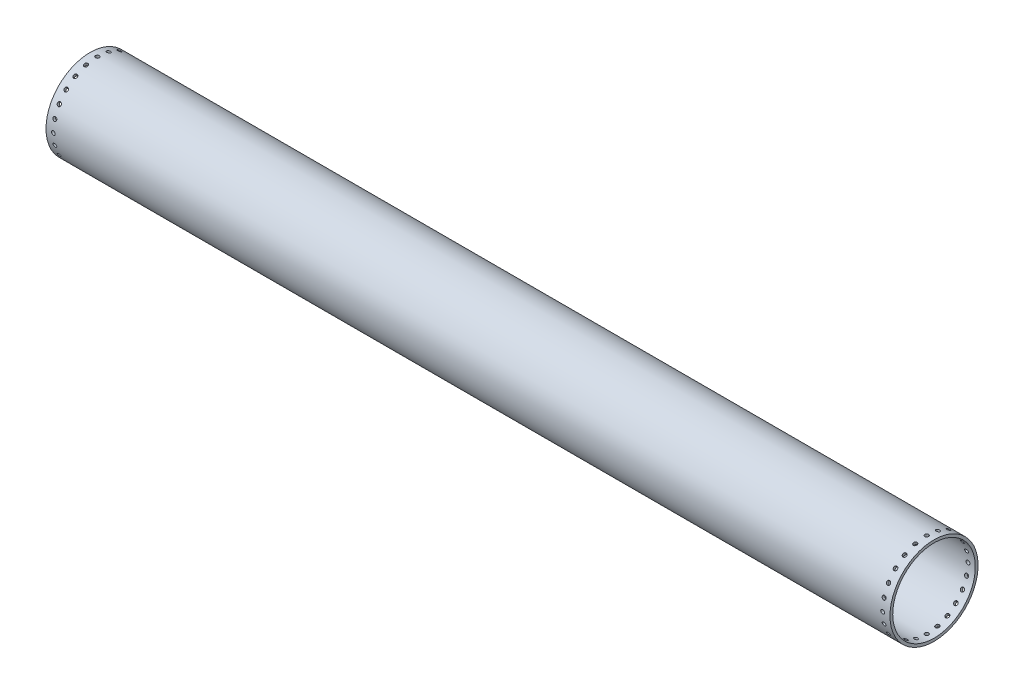
from build123d import *

# Parameters (mm, degrees)
TUBE_SKETCH_W                = 1459.687960479
TUBE_SKETCH_H                = 4.775
TOP_SCREW_HOLE_SKETCH_W      = 3.3
TOP_SCREW_HOLE_SKETCH_H      = 6.775
TOP_SCREW_HOLES_X24_COUNT    = 24
BOTTOM_SCREW_HOLE_SKETCH_W   = 3.3
BOTTOM_SCREW_HOLE_SKETCH_H   = 6.775
BOTTOM_SCREW_HOLES_X24_COUNT = 24


with BuildPart() as part:
    # Tube Sketch → Tube (revolve)
    with BuildSketch(Plane.XY):
        with Locations((729.84398024, 73.8125)):
            Rectangle(TUBE_SKETCH_W, TUBE_SKETCH_H)
    revolve(axis=Axis((-1000, 0, 0), (1, 0, 0)))

    # Top Screw Hole Sketch → Top Screw Hole (revolve, cut)
    with BuildSketch(Plane.XY):
        with Locations((14.35, 73.8125)):
            Rectangle(TOP_SCREW_HOLE_SKETCH_W, TOP_SCREW_HOLE_SKETCH_H)
    top_screw_hole = revolve(axis=Axis((12.7, 51.425, 0), (0, 1, 0)), mode=Mode.SUBTRACT)

    # Top Screw Holes x24: Top Screw Hole ×24 about axis
    top_screw_holes_x24_axis = Axis((1532.672358503, 0, 0), (-1, 0, 0))
    for i in range(1, TOP_SCREW_HOLES_X24_COUNT):
        add(top_screw_hole.rotate(top_screw_holes_x24_axis, i * 360 / TOP_SCREW_HOLES_X24_COUNT), mode=Mode.SUBTRACT)

    # Bottom Screw Hole Sketch → Bottom Screw Hole (revolve, cut)
    with BuildSketch(Plane.XY):
        with Locations((1448.637960479, 73.8125)):
            Rectangle(BOTTOM_SCREW_HOLE_SKETCH_W, BOTTOM_SCREW_HOLE_SKETCH_H)
    bottom_screw_hole = revolve(axis=Axis((1446.987960479, 51.425, 0), (0, 1, 0)), mode=Mode.SUBTRACT)

    # Bottom Screw Holes x24: Bottom Screw Hole ×24 about axis
    bottom_screw_holes_x24_axis = Axis((1532.672358503, 0, 0), (-1, 0, 0))
    for i in range(1, BOTTOM_SCREW_HOLES_X24_COUNT):
        add(bottom_screw_hole.rotate(bottom_screw_holes_x24_axis, i * 360 / BOTTOM_SCREW_HOLES_X24_COUNT), mode=Mode.SUBTRACT)


solid = part.part
